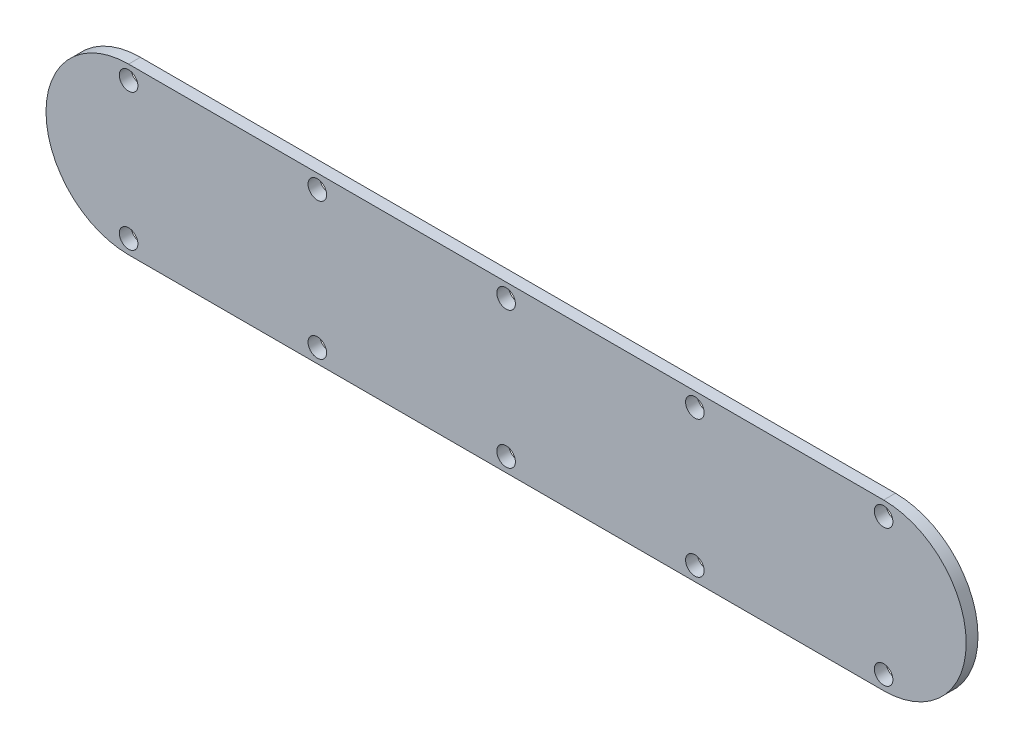
from build123d import *

# Parameters (mm, degrees)
SKETCH1_W                    = 247.65
SKETCH1_H                    = 44.45
BOSS_EXTRUDE1_DEPTH          = 3.175
CUT_EXTRUDE1_DEPTH           = 126.84379951
F_10_0_1935_DIAMETER_HOLE1_D = 4.999999906


with BuildPart() as part:
    # Sketch1 → Boss-Extrude1 (new body)
    with BuildSketch(Plane.XY):
        Rectangle(SKETCH1_W, SKETCH1_H)
    extrude(amount=BOSS_EXTRUDE1_DEPTH)

    # Sketch2 → Cut-Extrude1 (cut, through all)
    with BuildSketch(Plane.XY.offset(3.175)):
        with BuildLine():
            ThreePointArc((123.825, -6.4e-08), (117.315448189, -15.715448235), (101.6, -22.225))
            Line((101.6, -22.225), (123.825, -22.225))
            Line((123.825, -22.225), (123.825, -6.4e-08))
        make_face()
        with BuildLine():
            Line((-123.825, -22.225), (-101.6, -22.225))
            ThreePointArc((-101.6, -22.225), (-117.315448214, -15.71544821), (-123.825, 5e-09))
            Line((-123.825, 5e-09), (-123.825, -22.225))
        make_face()
        with BuildLine():
            ThreePointArc((101.6, 22.225), (117.315448235, 15.715448189), (123.825, -6.4e-08))
            Line((123.825, -6.4e-08), (123.825, 22.225))
            Line((123.825, 22.225), (101.6, 22.225))
        make_face()
        with BuildLine():
            Line((-123.825, 22.225), (-123.825, 5e-09))
            ThreePointArc((-123.825, 5e-09), (-117.31544821, 15.715448214), (-101.6, 22.225))
            Line((-101.6, 22.225), (-123.825, 22.225))
        make_face()
    extrude(amount=-CUT_EXTRUDE1_DEPTH, mode=Mode.SUBTRACT)

    # #10 (0.1935) Diameter Hole1 (through all)
    with Locations(Plane.XY.offset(3.175)):
        with Locations((-101.6, 18.415), (-50.8, 18.415), (0, 18.415), (50.8, 18.415), (101.6, 18.415), (101.6, -18.415), (50.8, -18.415), (0, -18.415), (-50.8, -18.415), (-101.6, -18.415)):
            Hole(F_10_0_1935_DIAMETER_HOLE1_D / 2)


solid = part.part
